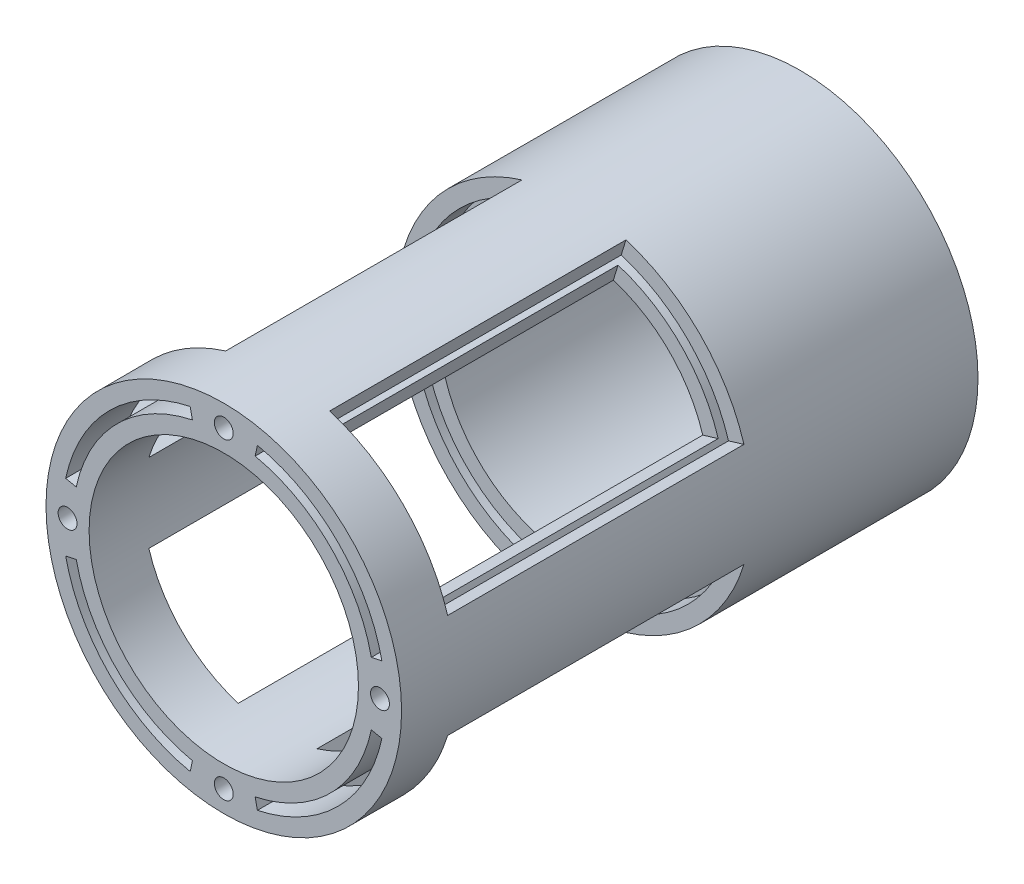
from build123d import *
from build123d.topology import SkipClean

# Parameters (mm, degrees)
CROQUIS1_R               = 33
CROQUIS1_R_2             = 25
BOSS_EXTRUDE1_DEPTH      = 107
SKETCH1_R                = 1.5
CUT_EXTRUDE1_DEPTH       = 5
SKETCH2_R                = 1.75
CUT_EXTRUDE2_DEPTH       = 5
CORTAR_EXTRUIR1_DEPTH    = 70
CORTAR_REVOLUCI_N2_ANGLE = 56
MATRIZC2_COUNT           = 4


with BuildPart() as part:
    # Croquis1 → Boss-Extrude1 (new body)
    with BuildSketch(Plane.XY):
        Circle(CROQUIS1_R)
        Circle(CROQUIS1_R_2, mode=Mode.SUBTRACT)
    extrude(amount=BOSS_EXTRUDE1_DEPTH)

    # Sketch1 → Cut-Extrude1 (cut)
    with BuildSketch(Plane(origin=(0, 0, 0), x_dir=(-1, 0, 0), z_dir=(0, 0, -1))):
        with Locations((-29, 0)):
            Circle(SKETCH1_R)
        with Locations((0, 29)):
            Circle(SKETCH1_R)
        with Locations((29, 0)):
            Circle(SKETCH1_R)
        with Locations((0, -29)):
            Circle(SKETCH1_R)
    extrude(amount=-CUT_EXTRUDE1_DEPTH, mode=Mode.SUBTRACT)

    # Sketch2 → Cut-Extrude2 (cut)
    with BuildSketch(Plane.XY.offset(107)):
        with Locations((-29, 0)):
            Circle(SKETCH2_R)
        with Locations((0, 29)):
            Circle(SKETCH2_R)
        with Locations((29, 0)):
            Circle(SKETCH2_R)
        with Locations((0, -29)):
            Circle(SKETCH2_R)
    extrude(amount=-CUT_EXTRUDE2_DEPTH, mode=Mode.SUBTRACT)

    # Croquis2 → Cortar-Extruir1 (cut)
    with BuildSketch(Plane.XY.offset(107)):
        with BuildLine():
            Line((-29.344428022, -6.237350725), (-27.388132821, -5.821527343))
            ThreePointArc((-27.388132821, -5.821527343), (-19.798989873, -19.798989873), (-5.821527343, -27.388132821))
            Line((-5.821527343, -27.388132821), (-6.237350725, -29.344428022))
            ThreePointArc((-6.237350725, -29.344428022), (-21.213203436, -21.213203436), (-29.344428022, -6.237350725))
        make_face()
        with BuildLine():
            Line((-29.344428022, 6.237350725), (-27.388132821, 5.821527343))
            ThreePointArc((-27.388132821, 5.821527343), (-19.798989873, 19.798989873), (-5.821527343, 27.388132821))
            Line((-5.821527343, 27.388132821), (-6.237350725, 29.344428022))
            ThreePointArc((-6.237350725, 29.344428022), (-21.213203436, 21.213203436), (-29.344428022, 6.237350725))
        make_face()
        with BuildLine():
            Line((6.237350725, 29.344428022), (5.821527343, 27.388132821))
            ThreePointArc((5.821527343, 27.388132821), (19.798989873, 19.798989873), (27.388132821, 5.821527343))
            Line((27.388132821, 5.821527343), (29.344428022, 6.237350725))
            ThreePointArc((29.344428022, 6.237350725), (21.213203436, 21.213203436), (6.237350725, 29.344428022))
        make_face()
        with BuildLine():
            Line((29.344428022, -6.237350725), (27.388132821, -5.821527343))
            ThreePointArc((27.388132821, -5.821527343), (19.798989873, -19.798989873), (5.821527343, -27.388132821))
            Line((5.821527343, -27.388132821), (6.237350725, -29.344428022))
            ThreePointArc((6.237350725, -29.344428022), (21.213203436, -21.213203436), (29.344428022, -6.237350725))
        make_face()
    extrude(amount=-CORTAR_EXTRUIR1_DEPTH, mode=Mode.SUBTRACT)

    # Croquis4 → Cortar-Revolución2 (revolve, cut)
    with SkipClean():  # the faces are left unmerged after this step: merging them gives an invalid solid
        with BuildSketch(Plane(origin=(0, 0, 0), x_dir=(0, 0, -1), z_dir=(0.9563047559630359, -0.29237170472273577, 0))):
            Polygon((-97, 33), (-97, 30), (-107, 30), (-107, 28), (-97, 28), (-97, 25), (-42, 25), (-42, 28), (-37, 28), (-37, 30), (-42, 30), (-42, 33), align=None)
        cortar_revoluci_n2 = revolve(axis=Axis((0, 0, 107), (0, 0, -1)), revolution_arc=CORTAR_REVOLUCI_N2_ANGLE, mode=Mode.SUBTRACT)

    # MatrizC2: Cortar-Revolución2 ×4 about axis
    with SkipClean():  # the faces are left unmerged after this step: merging them gives an invalid solid
        matrizc2_axis = Axis((0, 0, 107), (0, 0, -1))
        for i in range(1, MATRIZC2_COUNT):
            add(cortar_revoluci_n2.rotate(matrizc2_axis, i * 360 / MATRIZC2_COUNT), mode=Mode.SUBTRACT)


solid = part.part
